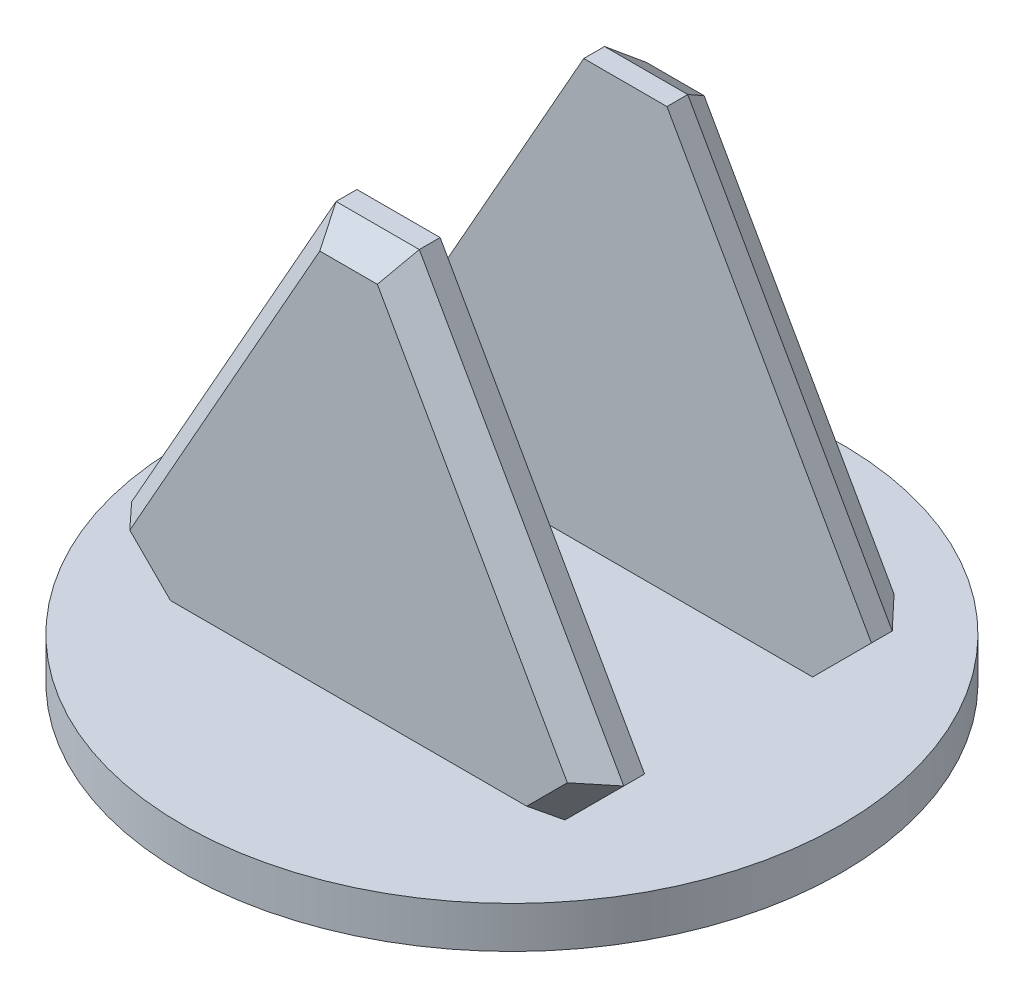
from build123d import *

# Parameters (mm, degrees)
BOSS_EXTRUDE1_DEPTH           = 7
BOSS_EXTRUDE1_TAPER           = 37
BOSS_EXTRUDE1_OTHER_WAY_DEPTH = 5
SKETCH2_R                     = 1.75
CUT_EXTRUDE1_DEPTH            = 3
SKETCH3_R                     = 79.208746666
BOSS_EXTRUDE2_DEPTH           = 10
MIRROR1_START                 = -64.52
MIRROR1_DEPTH                 = 5


with BuildPart() as part:
    # Sketch1 → Boss-Extrude1 (new body)
    with BuildSketch(Plane.XY):
        Polygon((-10, 101.234331062), (-59.142135624, 14.142135624), (-45, 0), (45, 0), (59.142135624, 14.142135624), (10, 101.234331062), align=None)
    extrude(amount=BOSS_EXTRUDE1_DEPTH, taper=BOSS_EXTRUDE1_TAPER)

    # Sketch1 → Boss-Extrude1 other way (add)
    with BuildSketch(Plane.XY):
        Polygon((-10, 101.234331062), (-59.142135624, 14.142135624), (-45, 0), (45, 0), (59.142135624, 14.142135624), (10, 101.234331062), align=None)
    extrude(amount=-BOSS_EXTRUDE1_OTHER_WAY_DEPTH)

    # Sketch2 → Cut-Extrude1 (cut)
    with BuildSketch(Plane(origin=(0, 0, -5), x_dir=(-1, 0, 0), z_dir=(0, 0, -1))):
        with Locations((0, 81.234331062)):
            Circle(SKETCH2_R)
    extrude(amount=-CUT_EXTRUDE1_DEPTH, mode=Mode.SUBTRACT)

    # Sketch3 → Boss-Extrude2 (add)
    with BuildSketch(Plane.XZ):
        with Locations((0, -32.26)):
            Circle(SKETCH3_R)
    extrude(amount=BOSS_EXTRUDE2_DEPTH)

    # Mirror1: read off the stored shape, not the designer's step
    # Mirror1 outline → Mirror1 (add)
    with BuildSketch(Plane.XY.offset(MIRROR1_START)):
        Polygon((-10, 101.234331062), (-59.142135624, 14.142135624), (-45, 0), (45, 0), (59.142135624, 14.142135624), (10, 101.234331062), align=None)
    extrude(amount=MIRROR1_DEPTH)

    # Mirror1 2: loft between two sections, ruled curve by curve
    mirror1_2_from = [
        Edge.make_line((-10, 101.234331062, -64.52), (-59.142135624, 14.142135624, -64.52)),
        Edge.make_line((10, 101.234331062, -64.52), (-10, 101.234331062, -64.52)),
        Edge.make_line((59.142135624, 14.142135624, -64.52), (10, 101.234331062, -64.52)),
        Edge.make_line((45, 0, -64.52), (59.142135624, 14.142135624, -64.52)),
        Edge.make_line((-45, 0, -64.52), (45, 0, -64.52)),
        Edge.make_line((-59.142135624, 14.142135624, -64.52), (-45, 0, -64.52)),
    ]
    mirror1_2_to = [
        Edge.make_line((-6.919711963, 95.959452712, -71.52), (-52.579336418, 15.039140921, -71.52)),
        Edge.make_line((6.919711963, 95.959452712, -71.52), (-6.919711963, 95.959452712, -71.52)),
        Edge.make_line((52.579336418, 15.039140921, -71.52), (6.919711963, 95.959452712, -71.52)),
        Edge.make_line((42.815073847, 5.274878351, -71.52), (52.579336418, 15.039140921, -71.52)),
        Edge.make_line((-42.815073847, 5.274878351, -71.52), (42.815073847, 5.274878351, -71.52)),
        Edge.make_line((-52.579336418, 15.039140921, -71.52), (-42.815073847, 5.274878351, -71.52)),
    ]
    mirror1_2 = Solid(Shell([*[Face.make_surface_from_curves(mirror1_2_from[k], mirror1_2_to[k]) for k in range(6)], Face(Wire(mirror1_2_from)), Face(Wire(mirror1_2_to))]))
    add(mirror1_2)


solid = part.part
